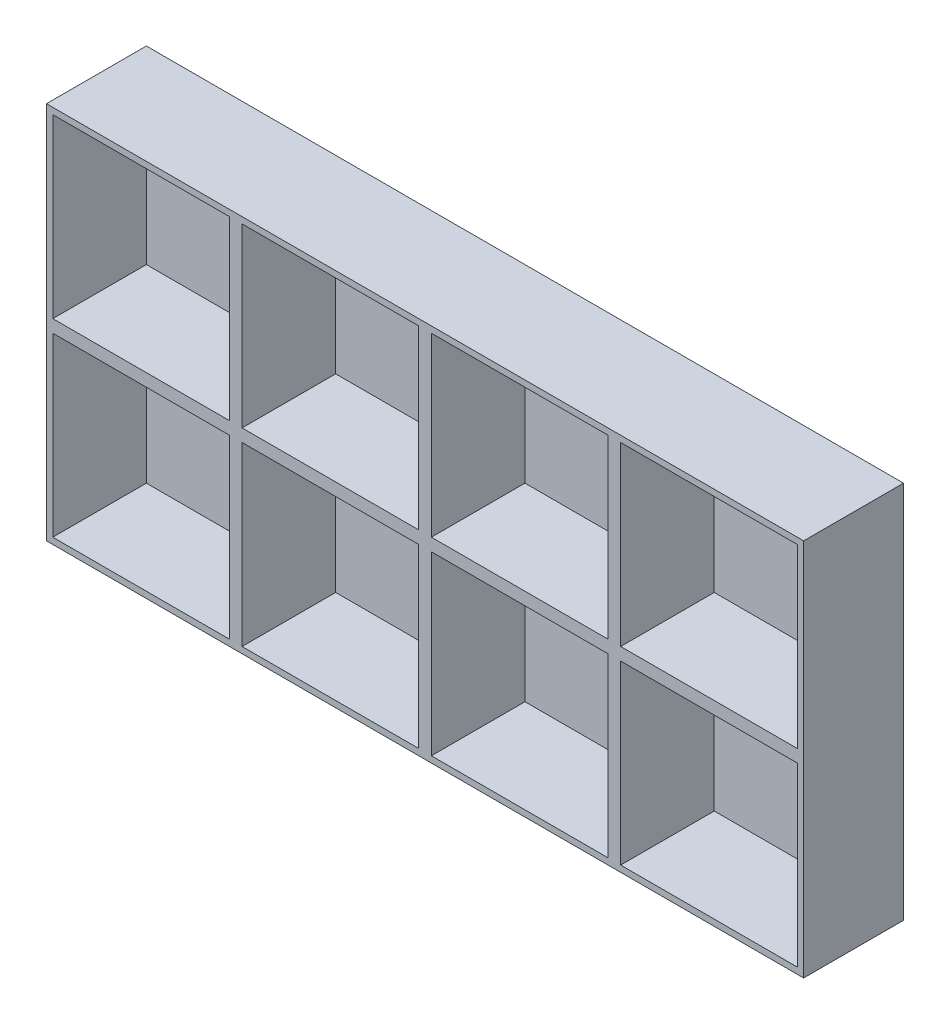
from build123d import *

# Parameters (mm, degrees)
ESQUISSE1_W        = 120
ESQUISSE1_H        = 30
ESQUISSE1_W_2      = 28
ESQUISSE1_H_2      = 28
BOSS_EXTRU_1_DEPTH = 14.833333343
ESQUISSE2_W        = 120
ESQUISSE2_H        = 60
BOSS_EXTRU_2_DEPTH = 1


with BuildPart() as part:
    # Esquisse1 → Boss.-Extru.1 (new body)
    with BuildSketch(Plane.XY):
        with Locations((60, 15)):
            Rectangle(ESQUISSE1_W, ESQUISSE1_H)
        with Locations((15, 15)):
            Rectangle(ESQUISSE1_W_2, ESQUISSE1_H_2, mode=Mode.SUBTRACT)
        with Locations((45, 15)):
            Rectangle(ESQUISSE1_W_2, ESQUISSE1_H_2, mode=Mode.SUBTRACT)
        with Locations((75, 15)):
            Rectangle(ESQUISSE1_W_2, ESQUISSE1_H_2, mode=Mode.SUBTRACT)
        with Locations((105, 15)):
            Rectangle(ESQUISSE1_W_2, ESQUISSE1_H_2, mode=Mode.SUBTRACT)
    boss_extru_1 = extrude(amount=BOSS_EXTRU_1_DEPTH)

    # Symétrie1: Boss.-Extru.1 across plane
    add(boss_extru_1.mirror(Plane(origin=(0, 0, 14.833333343), x_dir=(0, 0, 1), z_dir=(0, 1, 0))))

    # Esquisse2 → Boss.-Extru.2 (add)
    with BuildSketch(Plane(origin=(0, 0, 0), x_dir=(-1, 0, 0), z_dir=(0, 0, -1))):
        with Locations((-60, 0)):
            Rectangle(ESQUISSE2_W, ESQUISSE2_H)
    extrude(amount=BOSS_EXTRU_2_DEPTH)


solid = part.part
